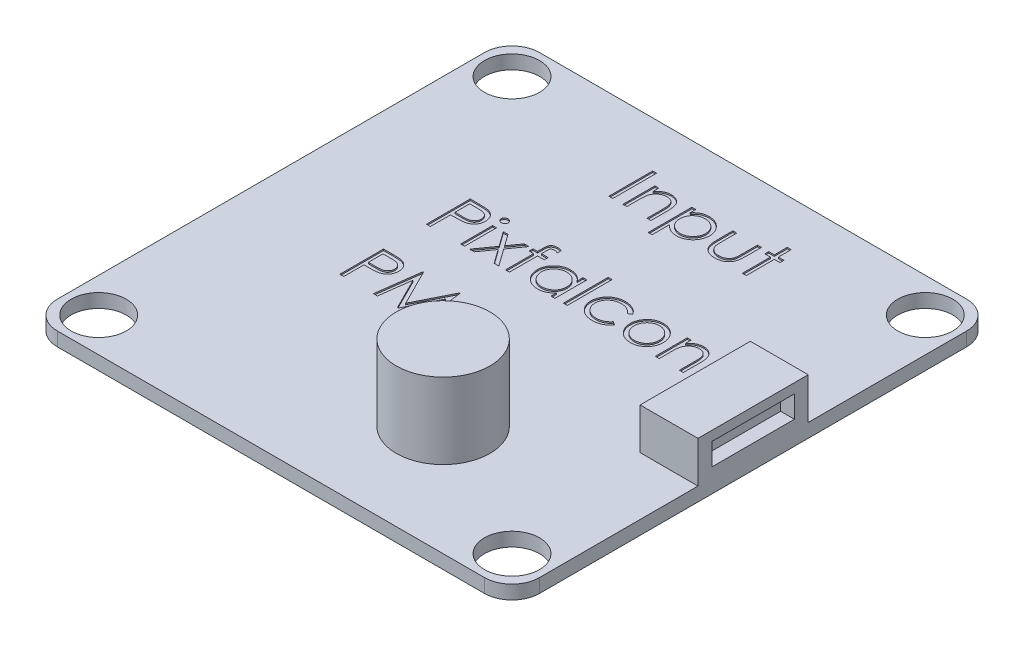
from build123d import *

# Parameters (mm, degrees)
SKETCH1_R           = 2
BOSS_EXTRUDE1_DEPTH = 1
SKETCH2_W           = 4.2
SKETCH2_H           = 8
BOSS_EXTRUDE2_DEPTH = 3
SKETCH3_W           = 6
SKETCH3_H           = 1.6
CUT_EXTRUDE1_DEPTH  = 1
SKETCH4_R           = 3.4
BOSS_EXTRUDE3_DEPTH = 5.5
SKETCH5_W           = 0.284935898
SKETCH5_H           = 2.320192307
SKETCH5_W_2         = 0.284935897
SKETCH5_H_2         = 3.256410256
SKETCH5_H_3         = 3.175
CUT_EXTRUDE2_DEPTH  = 0.1


with BuildPart() as part:
    # Sketch1 → Boss-Extrude1 (new body)
    with BuildSketch(Plane(origin=(0, 0, 0), x_dir=(1, 0, 0), z_dir=(0, 1, 0))):
        with BuildLine():
            Line((-15.5, 17.5), (15.5, 17.5))
            ThreePointArc((15.5, 17.5), (16.914213562, 16.914213562), (17.5, 15.5))
            Line((17.5, 15.5), (17.5, -15.5))
            ThreePointArc((17.5, -15.5), (16.914213562, -16.914213562), (15.5, -17.5))
            Line((15.5, -17.5), (-15.5, -17.5))
            ThreePointArc((-15.5, -17.5), (-16.914213562, -16.914213562), (-17.5, -15.5))
            Line((-17.5, -15.5), (-17.5, 15.5))
            ThreePointArc((-17.5, 15.5), (-16.914213562, 16.914213562), (-15.5, 17.5))
        make_face()
        with Locations((15, 15)):
            Circle(SKETCH1_R, mode=Mode.SUBTRACT)
        with Locations((15, -15)):
            Circle(SKETCH1_R, mode=Mode.SUBTRACT)
        with Locations((-15, -15)):
            Circle(SKETCH1_R, mode=Mode.SUBTRACT)
        with Locations((-15, 15)):
            Circle(SKETCH1_R, mode=Mode.SUBTRACT)
    extrude(amount=BOSS_EXTRUDE1_DEPTH)

    # Sketch2 → Boss-Extrude2 (add)
    with BuildSketch(Plane(origin=(0, 1, 0), x_dir=(1, 0, 0), z_dir=(0, 1, 0))):
        with Locations((15.4, 0)):
            Rectangle(SKETCH2_W, SKETCH2_H)
    extrude(amount=BOSS_EXTRUDE2_DEPTH)

    # Sketch3 → Cut-Extrude1 (cut)
    with BuildSketch(Plane(origin=(17.5, 0, 0), x_dir=(0, 0, -1), z_dir=(1, 0, 0))):
        with Locations((0, 2.5)):
            Rectangle(SKETCH3_W, SKETCH3_H)
    extrude(amount=-CUT_EXTRUDE1_DEPTH, mode=Mode.SUBTRACT)

    # Sketch4 → Boss-Extrude3 (add)
    with BuildSketch(Plane(origin=(0, 1, 0), x_dir=(1, 0, 0), z_dir=(0, 1, 0))):
        with Locations((4.5, -9.5)):
            Circle(SKETCH4_R)
    extrude(amount=BOSS_EXTRUDE3_DEPTH)

    # Sketch5 → Cut-Extrude2 (cut)
    # profile 1 of 17: a face of its own
    with BuildSketch(Plane(origin=(0, 1, 0), x_dir=(1, 0, 0), z_dir=(0, 1, 0))):
        with BuildLine():
            Line((-8.813380042, 5.781823516), (-8.190718784, 5.781823516))
            add(Edge.make_bspline(
                [(-8.190718784, 5.781823516), (-8.147891748, 5.781776438), (-8.065833244, 5.781686236), (-7.948163158, 5.778951431), (-7.841292901, 5.775298646), (-7.745452913, 5.770235072), (-7.66034831, 5.764251022), (-7.586364188, 5.7558581), (-7.522919019, 5.747094832), (-7.484903883, 5.738185414), (-7.467566741, 5.734122194)],
                knots=[0, 0, 0, 0, 1.415646017, 2.712440637, 3.8905458, 4.950247383, 5.884950622, 6.709939814, 7.411656543, 8, 8, 8, 8], degree=3))
            add(Edge.make_bspline(
                [(-7.467566741, 5.734122194), (-7.445619749, 5.728115139), (-7.40224292, 5.716242579), (-7.339739831, 5.692462987), (-7.280273128, 5.664267023), (-7.223638786, 5.632132449), (-7.170532754, 5.594680544), (-7.120162702, 5.553429477), (-7.072973149, 5.507426839), (-7.029229457, 5.457188597), (-6.989056819, 5.403558121), (-6.95446775, 5.345734812), (-6.925505194, 5.284691987), (-6.900664655, 5.220472104), (-6.882786271, 5.152535882), (-6.869318012, 5.081355365), (-6.860769436, 5.006938182), (-6.859950683, 4.956083873), (-6.859533888, 4.930195912)],
                knots=[0, 0, 0, 0, 0.999701418, 1.975846123, 2.934577507, 3.890451536, 4.834027766, 5.787354733, 6.749476667, 7.726910423, 8.712836071, 9.690891519, 10.682875813, 11.679750201, 12.712814741, 13.765529915, 14.8625177, 16, 16, 16, 16], degree=3))
            add(Edge.make_bspline(
                [(-6.859533888, 4.930195912), (-6.859916181, 4.904090357), (-6.860664162, 4.853013076), (-6.869641506, 4.77828919), (-6.881733894, 4.706880364), (-6.900327649, 4.638944934), (-6.924680509, 4.574886342), (-6.9532483, 4.513725653), (-6.987704789, 4.45650338), (-7.027296884, 4.40301178), (-7.071340116, 4.353200645), (-7.119648139, 4.307430939), (-7.172025925, 4.265970575), (-7.228307017, 4.228726606), (-7.289040094, 4.196562695), (-7.353304048, 4.167754283), (-7.421657458, 4.143559821), (-7.468958167, 4.130832551), (-7.493007446, 4.124361577)],
                knots=[0, 0, 0, 0, 1.121902311, 2.195077645, 3.232258892, 4.234102512, 5.217864754, 6.176164875, 7.132989551, 8.084763148, 9.034132444, 9.988522005, 10.94243251, 11.903244335, 12.886203696, 13.894208494, 14.929344452, 16, 16, 16, 16], degree=3))
            add(Edge.make_bspline(
                [(-7.493007446, 4.124361577), (-7.51289867, 4.120131587), (-7.556491445, 4.110861318), (-7.6282852, 4.100512218), (-7.711874229, 4.091678823), (-7.80714444, 4.085055648), (-7.914010318, 4.079385671), (-8.032529673, 4.0748789), (-8.162935157, 4.072402532), (-8.2538955, 4.072274813), (-8.301385851, 4.072208131)],
                knots=[0, 0, 0, 0, 0.601384939, 1.31797006, 2.144135048, 3.087295005, 4.142315834, 5.309527816, 6.595305764, 8, 8, 8, 8], degree=3))
            Line((-8.301385851, 4.072208131), (-8.528444145, 4.072208131))
            Line((-8.528444145, 4.072208131), (-8.528444145, 2.606823516))
            Line((-8.528444145, 2.606823516), (-8.813380042, 2.606823516))
            Line((-8.813380042, 2.606823516), (-8.813380042, 5.781823516))
        make_face()
        with BuildLine():
            Line((-8.528444145, 5.45618249), (-8.528444145, 4.397849157))
            Line((-8.528444145, 4.397849157), (-7.972564738, 4.390852963))
            add(Edge.make_bspline(
                [(-7.972564738, 4.390852963), (-7.945423091, 4.390838935), (-7.893026701, 4.390811855), (-7.817338127, 4.394427022), (-7.747116845, 4.398600362), (-7.682578551, 4.404710807), (-7.623694154, 4.413347948), (-7.570365467, 4.422067167), (-7.523006003, 4.434681318), (-7.467580298, 4.451665816), (-7.405818976, 4.48063326), (-7.338629129, 4.522679232), (-7.281687239, 4.576273874), (-7.232412785, 4.636533407), (-7.193309595, 4.703570475), (-7.164683802, 4.775297296), (-7.147864324, 4.850978274), (-7.145608991, 4.902765371), (-7.144469786, 4.928923876)],
                knots=[0, 0, 0, 0, 1.160613943, 2.240541288, 3.23993089, 4.169200891, 5.011653406, 5.7853311, 6.478053781, 7.106038997, 8.262395093, 9.384106736, 10.481365981, 11.59014053, 12.70357646, 13.786202915, 14.881775077, 16, 16, 16, 16], degree=3))
            add(Edge.make_bspline(
                [(-7.144469786, 4.928923876), (-7.145615186, 4.954449528), (-7.147892101, 5.005191364), (-7.164815634, 5.079557811), (-7.19325394, 5.150528771), (-7.23267528, 5.216725784), (-7.280519019, 5.276768485), (-7.33612628, 5.328926593), (-7.399366167, 5.370856281), (-7.458192777, 5.397919329), (-7.510445281, 5.414443186), (-7.555831417, 5.426004577), (-7.607076528, 5.435235306), (-7.6641973, 5.442709712), (-7.726750999, 5.449108209), (-7.795275042, 5.453449774), (-7.869509847, 5.455991095), (-7.92104515, 5.456117147), (-7.94776005, 5.45618249)],
                knots=[0, 0, 0, 0, 1.120700087, 2.227813068, 3.331159281, 4.466773991, 5.599788987, 6.693661531, 7.80175334, 8.91857717, 9.525282508, 10.207424825, 10.974604443, 11.810962634, 12.737642355, 13.736264703, 14.826523623, 16, 16, 16, 16], degree=3))
            Line((-7.94776005, 5.45618249), (-8.528444145, 5.45618249))
        make_face(mode=Mode.SUBTRACT)
    # profile 2 of 17: a face of its own
    with BuildSketch(Plane(origin=(0, 1, 0), x_dir=(1, 0, 0), z_dir=(0, 1, 0))):
        with BuildLine():
            add(Edge.make_bspline(
                [(-6.189171308, 5.9039389), (-6.1714899, 5.903118705), (-6.136866308, 5.901512605), (-6.086798129, 5.887758979), (-6.04120784, 5.864445693), (-6.000769468, 5.833167697), (-5.966069542, 5.796383559), (-5.941775612, 5.753511109), (-5.92616151, 5.70719363), (-5.924275963, 5.674885656), (-5.92331594, 5.658436096)],
                knots=[0, 0, 0, 0, 1.055194115, 2.066272739, 3.074728998, 4.095836921, 5.109056067, 6.073838105, 7.019297344, 8, 8, 8, 8], degree=3))
            add(Edge.make_bspline(
                [(-5.92331594, 5.658436096), (-5.924297613, 5.642413546), (-5.926238266, 5.610738862), (-5.941763551, 5.565224355), (-5.966276581, 5.522947612), (-6.000747217, 5.486234896), (-6.041213736, 5.454974191), (-6.086796563, 5.431656321), (-6.13686672, 5.41790391), (-6.171490039, 5.416297643), (-6.189171308, 5.415477362)],
                knots=[0, 0, 0, 0, 0.96129708, 1.900370562, 2.859976407, 3.87933698, 4.906634145, 5.921202961, 6.938410037, 8, 8, 8, 8], degree=3))
            add(Edge.make_bspline(
                [(-6.189171308, 5.415477362), (-6.206650386, 5.416266322), (-6.240671128, 5.417801931), (-6.289989621, 5.431926161), (-6.335191179, 5.45498217), (-6.375708418, 5.48603021), (-6.409481522, 5.523173081), (-6.434063574, 5.565198555), (-6.449553004, 5.61074543), (-6.451498488, 5.642415753), (-6.452482606, 5.658436096)],
                knots=[0, 0, 0, 0, 1.054934014, 2.053291228, 3.073705704, 4.106921865, 5.123545215, 6.088680038, 7.033164197, 8, 8, 8, 8], degree=3))
            add(Edge.make_bspline(
                [(-6.452482606, 5.658436096), (-6.451520049, 5.674883367), (-6.449629526, 5.707186844), (-6.434051964, 5.753537338), (-6.409686281, 5.796156272), (-6.375686055, 5.833372261), (-6.335197131, 5.864437762), (-6.289988083, 5.887489153), (-6.240671535, 5.901614582), (-6.206650524, 5.903150025), (-6.189171308, 5.9039389)],
                knots=[0, 0, 0, 0, 0.98631895, 1.937192651, 2.907499808, 3.917963147, 4.944918757, 5.95915025, 6.951458133, 8, 8, 8, 8], degree=3))
        make_face()
    # profile 3 of 17: a face of its own
    with BuildSketch(Plane(origin=(0, 1, 0), x_dir=(1, 0, 0), z_dir=(0, 1, 0))):
        with Locations((-6.187899273, 3.76691967)):
            Rectangle(SKETCH5_W, SKETCH5_H)
    # profile 4 of 17: a face of its own
    with BuildSketch(Plane(origin=(0, 1, 0), x_dir=(1, 0, 0), z_dir=(0, 1, 0))):
        Polygon((-5.556969786, 4.927015823), (-5.21797239, 4.927015823), (-4.620751837, 4.090016625), (-4.023531284, 4.927015823), (-3.684533888, 4.927015823), (-4.45093513, 3.852782049), (-3.562418504, 2.606823516), (-3.901415899, 2.606823516), (-4.620751837, 3.614911456), (-5.340087774, 2.606823516), (-5.67908517, 2.606823516), (-4.789932526, 3.852782049), align=None)
    # profile 5 of 17: a face of its own
    with BuildSketch(Plane(origin=(0, 1, 0), x_dir=(1, 0, 0), z_dir=(0, 1, 0))):
        with BuildLine():
            Line((-2.259854401, 5.844153243), (-2.259854401, 5.547769029))
            add(Edge.make_bspline(
                [(-2.259854401, 5.547769029), (-2.286831722, 5.558610177), (-2.338035238, 5.579186902), (-2.413546151, 5.601561241), (-2.482968736, 5.616017234), (-2.527558336, 5.618045555), (-2.548606404, 5.619003003)],
                knots=[0, 0, 0, 0, 1.16548392, 2.212112691, 3.15604595, 4, 4, 4, 4], degree=3))
            add(Edge.make_bspline(
                [(-2.548606404, 5.619003003), (-2.562824747, 5.618412144), (-2.590346717, 5.617268439), (-2.629901163, 5.611437075), (-2.665542089, 5.599550963), (-2.697206474, 5.584102976), (-2.723468677, 5.56473168), (-2.745953323, 5.545268691), (-2.762251532, 5.523329278), (-2.771100663, 5.502900048), (-2.776498164, 5.483985219), (-2.778122066, 5.464613848), (-2.782099809, 5.440824856), (-2.78320907, 5.411647769), (-2.785737611, 5.37799031), (-2.785513872, 5.339140197), (-2.787585717, 5.295708789), (-2.787275552, 5.264956148), (-2.787113015, 5.248840743)],
                knots=[0, 0, 0, 0, 1.311993654, 2.539582093, 3.670788641, 4.763509788, 5.772417512, 6.671800701, 7.496729179, 8.266799162, 8.712543678, 9.304149002, 10.05334463, 10.934920737, 11.99209668, 13.165090968, 14.514413552, 16, 16, 16, 16], degree=3))
            Line((-2.787113015, 5.248840743), (-2.787113015, 4.927015823))
            Line((-2.787113015, 4.927015823), (-2.300559529, 4.927015823))
            Line((-2.300559529, 4.927015823), (-2.300559529, 4.642079926))
            Line((-2.300559529, 4.642079926), (-2.787749032, 4.642079926))
            Line((-2.787749032, 4.642079926), (-2.789021068, 2.606823516))
            Line((-2.789021068, 2.606823516), (-3.073956965, 2.606823516))
            Line((-3.073956965, 2.606823516), (-3.073956965, 4.642079926))
            Line((-3.073956965, 4.642079926), (-3.399597991, 4.642079926))
            Line((-3.399597991, 4.642079926), (-3.399597991, 4.927015823))
            Line((-3.399597991, 4.927015823), (-3.073956965, 4.927015823))
            Line((-3.073956965, 4.927015823), (-3.073956965, 5.297814101))
            add(Edge.make_bspline(
                [(-3.073956965, 5.297814101), (-3.073934092, 5.318384091), (-3.073890212, 5.357845626), (-3.070816948, 5.414641332), (-3.068190116, 5.467095475), (-3.062958053, 5.514800877), (-3.056914934, 5.558204165), (-3.048264275, 5.596660564), (-3.040089674, 5.63120616), (-3.025259166, 5.670306427), (-3.003104724, 5.714620378), (-2.967245189, 5.761450629), (-2.92425296, 5.803455831), (-2.872901124, 5.838841073), (-2.815102031, 5.868246542), (-2.750802677, 5.889330223), (-2.680703033, 5.901250484), (-2.632182257, 5.903023231), (-2.607120026, 5.9039389)],
                knots=[0, 0, 0, 0, 1.116398763, 2.141702935, 3.087165306, 3.966655413, 4.746276475, 5.464069668, 6.106083417, 6.67047701, 7.730773247, 8.782666744, 9.856985883, 10.980834087, 12.154321827, 13.366232824, 14.639591414, 16, 16, 16, 16], degree=3))
            add(Edge.make_bspline(
                [(-2.607120026, 5.9039389), (-2.581650395, 5.903070419), (-2.528178257, 5.901247089), (-2.444542768, 5.889968213), (-2.354194498, 5.870490922), (-2.292204056, 5.853184555), (-2.259854401, 5.844153243)],
                knots=[0, 0, 0, 0, 0.864728408, 1.815451418, 2.859995356, 4, 4, 4, 4], degree=3))
        make_face()
    # profile 6 of 17: a face of its own
    with BuildSketch(Plane(origin=(0, 1, 0), x_dir=(1, 0, 0), z_dir=(0, 1, 0))):
        with BuildLine():
            Line((0.508094317, 4.927015823), (0.508094317, 2.606823516))
            Line((0.508094317, 2.606823516), (0.223158419, 2.606823516))
            Line((0.223158419, 2.606823516), (0.223158419, 3.008150639))
            add(Edge.make_bspline(
                [(0.223158419, 3.008150639), (0.191028517, 2.971829007), (0.128326607, 2.900946887), (0.023605021, 2.808343773), (-0.087400397, 2.731800581), (-0.204150881, 2.669978872), (-0.326541002, 2.623540364), (-0.454299453, 2.590532919), (-0.587478348, 2.569311369), (-0.678421556, 2.567192263), (-0.724507847, 2.566118388)],
                knots=[0, 0, 0, 0, 1.074387032, 2.096679803, 3.090159297, 4.057316773, 5.018401886, 5.985159533, 6.978961417, 8, 8, 8, 8], degree=3))
            add(Edge.make_bspline(
                [(-0.724507847, 2.566118388), (-0.765481633, 2.567230882), (-0.846283755, 2.569424771), (-0.965145846, 2.586444861), (-1.07952953, 2.613777639), (-1.189542892, 2.651787732), (-1.294474053, 2.702207477), (-1.395221426, 2.762569895), (-1.491263082, 2.834452648), (-1.581135121, 2.916628931), (-1.663895579, 3.005887241), (-1.73652259, 3.101087844), (-1.79707717, 3.201819077), (-1.847713957, 3.306805581), (-1.886717784, 3.416855544), (-1.913908152, 3.531588403), (-1.930908415, 3.650868503), (-1.933101397, 3.732093641), (-1.934213375, 3.773279846)],
                knots=[0, 0, 0, 0, 1.033919861, 2.038935746, 3.024066025, 3.998881131, 4.97069526, 5.957263378, 6.95902576, 7.993208707, 9.027059324, 10.027763471, 11.009749337, 11.988697705, 12.965288445, 13.950418724, 14.960734635, 16, 16, 16, 16], degree=3))
            add(Edge.make_bspline(
                [(-1.934213375, 3.773279846), (-1.933076751, 3.813614777), (-1.930829707, 3.89335476), (-1.91409, 4.010629007), (-1.885940443, 4.123584858), (-1.846436324, 4.231858657), (-1.795779693, 4.335581416), (-1.734159214, 4.434826496), (-1.661570437, 4.529867307), (-1.577884325, 4.618469062), (-1.487229212, 4.700312048), (-1.39024772, 4.771440254), (-1.289352315, 4.83286911), (-1.182978012, 4.881540477), (-1.072699282, 4.920918736), (-0.95753437, 4.948162929), (-0.837962438, 4.964216927), (-0.756781777, 4.966541721), (-0.7156036, 4.967720952)],
                knots=[0, 0, 0, 0, 1.020392517, 2.01726096, 2.990465484, 3.961182959, 4.928053699, 5.906110375, 6.912531644, 7.948652711, 8.985773172, 9.998621852, 10.987621588, 11.969261332, 12.953316658, 13.946091881, 14.958173133, 16, 16, 16, 16], degree=3))
            add(Edge.make_bspline(
                [(-0.7156036, 4.967720952), (-0.66825087, 4.966416706), (-0.575394403, 4.963859141), (-0.439569709, 4.942575095), (-0.311077933, 4.906617343), (-0.188927199, 4.85770647), (-0.073556148, 4.792710837), (0.033942988, 4.710723301), (0.134695248, 4.612260938), (0.193097369, 4.536632035), (0.223158419, 4.497703924)],
                knots=[0, 0, 0, 0, 1.038897134, 2.037228247, 3.008116434, 3.962042015, 4.918381754, 5.904844433, 6.921570401, 8, 8, 8, 8], degree=3))
            Line((0.223158419, 4.497703924), (0.223158419, 4.927015823))
            Line((0.223158419, 4.927015823), (0.508094317, 4.927015823))
        make_face()
        with BuildLine():
            add(Edge.make_bspline(
                [(-0.711787494, 4.682785054), (-0.753438358, 4.681303111), (-0.835650538, 4.678377992), (-0.956340454, 4.655542036), (-1.071831908, 4.617546725), (-1.181547275, 4.565583858), (-1.283753443, 4.500243504), (-1.375096988, 4.421211963), (-1.456325009, 4.330645529), (-1.524640363, 4.2289529), (-1.580330314, 4.119934203), (-1.619488979, 4.005974892), (-1.645314653, 3.889130376), (-1.647953097, 3.80987994), (-1.649277478, 3.770099758)],
                knots=[0, 0, 0, 0, 1.031046209, 2.035121221, 3.029706178, 4.034933723, 5.034054252, 6.02443088, 7.017295772, 8.038157696, 9.050218397, 10.03989886, 11.016116709, 12, 12, 12, 12], degree=3))
            add(Edge.make_bspline(
                [(-1.649277478, 3.770099758), (-1.647585753, 3.730557303), (-1.644208935, 3.651627388), (-1.619942234, 3.534623579), (-1.579229777, 3.420637412), (-1.523674477, 3.310636368), (-1.454108753, 3.208506505), (-1.373474047, 3.11621368), (-1.280990578, 3.036848125), (-1.178549196, 2.970411183), (-1.069140537, 2.916742325), (-0.954084042, 2.879399209), (-0.835542571, 2.855289365), (-0.754940811, 2.852473161), (-0.714331565, 2.851054285)],
                knots=[0, 0, 0, 0, 0.979072187, 1.954306742, 2.945804271, 3.96968567, 4.997920485, 5.998718438, 6.996577872, 8.005894225, 9.015743152, 10.005417472, 10.995077863, 12, 12, 12, 12], degree=3))
            add(Edge.make_bspline(
                [(-0.714331565, 2.851054285), (-0.673105094, 2.852560109), (-0.591109734, 2.855555045), (-0.470061763, 2.878488764), (-0.352591332, 2.916379031), (-0.240298632, 2.96890181), (-0.135690428, 3.033995983), (-0.041803067, 3.110202416), (0.037586418, 3.198833161), (0.104889714, 3.296238944), (0.157663128, 3.403020541), (0.196104267, 3.516716556), (0.218831739, 3.637330949), (0.221696251, 3.719757512), (0.223158419, 3.761831529)],
                knots=[0, 0, 0, 0, 1.01762866, 2.023962475, 3.030623092, 4.058876274, 5.077231937, 6.066672613, 7.034107872, 8.005628644, 8.981990164, 9.965428785, 10.961468474, 12, 12, 12, 12], degree=3))
            add(Edge.make_bspline(
                [(0.223158419, 3.761831529), (0.222287874, 3.793887989), (0.220574365, 3.856985248), (0.207483777, 3.949629496), (0.18666038, 4.038287947), (0.157317782, 4.123053815), (0.118772117, 4.203458436), (0.072283073, 4.280079133), (0.017033129, 4.352517404), (-0.046088317, 4.419775761), (-0.115181036, 4.481122623), (-0.188291798, 4.535881613), (-0.266286804, 4.580865714), (-0.347854402, 4.61809601), (-0.433136113, 4.647722525), (-0.522825889, 4.667487075), (-0.615970399, 4.681058224), (-0.679512178, 4.682203383), (-0.711787494, 4.682785054)],
                knots=[0, 0, 0, 0, 1.050140795, 2.067009409, 3.05949893, 4.030605086, 5.00011959, 5.97591094, 6.962425594, 7.979863591, 8.993523472, 9.986985069, 10.967611495, 11.937549037, 12.921786183, 13.919465291, 14.943216303, 16, 16, 16, 16], degree=3))
        make_face(mode=Mode.SUBTRACT)
    # profile 7 of 17: a face of its own
    with BuildSketch(Plane(origin=(0, 1, 0), x_dir=(1, 0, 0), z_dir=(0, 1, 0))):
        with Locations((1.261139189, 4.235028644)):
            Rectangle(SKETCH5_W_2, SKETCH5_H_2)
    # profile 8 of 17: a face of its own
    with BuildSketch(Plane(origin=(0, 1, 0), x_dir=(1, 0, 0), z_dir=(0, 1, 0))):
        with BuildLine():
            Line((4.334376368, 4.42392588), (4.095869758, 4.275733772))
            add(Edge.make_bspline(
                [(4.095869758, 4.275733772), (4.069716951, 4.308235244), (4.018239592, 4.372208872), (3.928850428, 4.454767883), (3.833590073, 4.525676557), (3.730830701, 4.583464959), (3.62071644, 4.628115847), (3.503681539, 4.659711819), (3.379742688, 4.679400668), (3.294774972, 4.681638441), (3.251238347, 4.682785054)],
                knots=[0, 0, 0, 0, 1.026593902, 2.0206758, 2.988051866, 3.946915611, 4.916868779, 5.907761954, 6.927957743, 8, 8, 8, 8], degree=3))
            add(Edge.make_bspline(
                [(3.251238347, 4.682785054), (3.216441294, 4.681826347), (3.147909442, 4.6799382), (3.047301717, 4.668135824), (2.951469011, 4.646689145), (2.859810654, 4.618430777), (2.77297856, 4.5805573), (2.690745227, 4.534465593), (2.612381247, 4.48089877), (2.540157488, 4.418840633), (2.474091175, 4.351350413), (2.416851446, 4.279002418), (2.367015799, 4.203963659), (2.327912539, 4.124360293), (2.29591292, 4.042013445), (2.274861109, 3.955368733), (2.260832421, 3.865536183), (2.259227388, 3.804287404), (2.25841483, 3.773279846)],
                knots=[0, 0, 0, 0, 1.112346261, 2.190735716, 3.231507886, 4.247384806, 5.251966152, 6.253067467, 7.256802811, 8.280671706, 9.291813951, 10.270744147, 11.225547591, 12.165006084, 13.100104208, 14.043489273, 15.009504848, 16, 16, 16, 16], degree=3))
            add(Edge.make_bspline(
                [(2.25841483, 3.773279846), (2.260028866, 3.732667776), (2.26323519, 3.651990848), (2.288364371, 3.532902856), (2.329498226, 3.417764937), (2.385793562, 3.307394555), (2.456983534, 3.205255572), (2.540597217, 3.113649152), (2.636680956, 3.034350327), (2.744388142, 2.968607393), (2.861189809, 2.91575601), (2.985822262, 2.878102929), (3.117267062, 2.855376848), (3.207261754, 2.852513957), (3.2531464, 2.851054285)],
                knots=[0, 0, 0, 0, 0.966302908, 1.919585723, 2.883856336, 3.870342332, 4.860282998, 5.839159637, 6.814385684, 7.815993281, 8.834850808, 9.858348828, 10.908058873, 12, 12, 12, 12], degree=3))
            add(Edge.make_bspline(
                [(3.2531464, 2.851054285), (3.295197175, 2.852233115), (3.377838105, 2.854549828), (3.498639857, 2.874079673), (3.613647347, 2.906050683), (3.722856489, 2.950634623), (3.826067726, 3.008263155), (3.922614191, 3.079346117), (4.014416993, 3.161838605), (4.06838925, 3.22562705), (4.095869758, 3.258105567)],
                knots=[0, 0, 0, 0, 1.039848629, 2.043578496, 3.018386758, 3.987534228, 4.954977003, 5.934852016, 6.948509513, 8, 8, 8, 8], degree=3))
            Line((4.095869758, 3.258105567), (4.334376368, 3.10164523))
            add(Edge.make_bspline(
                [(4.334376368, 3.10164523), (4.320236095, 3.080880071), (4.292002483, 3.039418674), (4.244805995, 2.980958654), (4.19389729, 2.926238271), (4.139474981, 2.875330874), (4.082249679, 2.827018243), (4.020266504, 2.783610029), (3.955524071, 2.742666297), (3.887262335, 2.70582462), (3.816187059, 2.672708171), (3.742398254, 2.644231894), (3.666216566, 2.619766156), (3.587552425, 2.60031942), (3.506250746, 2.584797445), (3.422521792, 2.574498015), (3.3363944, 2.566809725), (3.278181091, 2.566350831), (3.248694277, 2.566118388)],
                knots=[0, 0, 0, 0, 0.954134338, 1.905101784, 2.851144739, 3.791306361, 4.734911809, 5.6936923, 6.663572882, 7.643865596, 8.638447847, 9.640600242, 10.646758161, 11.676244097, 12.717260333, 13.78922464, 14.880174919, 16, 16, 16, 16], degree=3))
            add(Edge.make_bspline(
                [(3.248694277, 2.566118388), (3.203690118, 2.566926906), (3.11548164, 2.568511607), (2.986374794, 2.585936438), (2.862990967, 2.612205133), (2.745372314, 2.649909377), (2.633500523, 2.698445852), (2.527479909, 2.75773391), (2.427661521, 2.828265891), (2.335032453, 2.908786403), (2.249959284, 2.996090413), (2.176910526, 3.090297125), (2.113550888, 3.187942932), (2.062671474, 3.291184431), (2.022170333, 3.398649447), (1.994498092, 3.511198879), (1.976600402, 3.627904853), (1.97452905, 3.70749111), (1.973478932, 3.747839141)],
                knots=[0, 0, 0, 0, 1.1129367, 2.181364009, 3.217532258, 4.231199276, 5.232079859, 6.230262199, 7.231623845, 8.250719726, 9.263571943, 10.242672461, 11.195837495, 12.138959767, 13.085126421, 14.0317438, 15.002148558, 16, 16, 16, 16], degree=3))
            add(Edge.make_bspline(
                [(1.973478932, 3.747839141), (1.973878997, 3.775215292), (1.974674792, 3.829670976), (1.983802397, 3.910492929), (1.995593869, 3.990238538), (2.015574359, 4.067896969), (2.038652647, 4.144646054), (2.068112593, 4.219560724), (2.102670559, 4.292989106), (2.141906254, 4.364742046), (2.186073901, 4.433639129), (2.234951877, 4.498729953), (2.286699239, 4.560796454), (2.343736855, 4.617695866), (2.403644255, 4.671703697), (2.468116328, 4.721377138), (2.536783279, 4.76686218), (2.608613864, 4.808999887), (2.683566281, 4.846518803), (2.761187475, 4.87884324), (2.841009723, 4.906468077), (2.923160711, 4.92833831), (3.007095168, 4.946678402), (3.093474524, 4.958215305), (3.181968326, 4.966367138), (3.241890575, 4.967265928), (3.272226929, 4.967720952)],
                knots=[0, 0, 0, 0, 0.990994727, 1.971252077, 2.943264845, 3.907940874, 4.872158414, 5.844625996, 6.82015047, 7.809835459, 8.804511986, 9.781214284, 10.756496977, 11.728388426, 12.696359165, 13.676225489, 14.672885716, 15.677705647, 16.690706858, 17.706033469, 18.721040654, 19.747369689, 20.783475414, 21.830280724, 22.901553713, 24, 24, 24, 24], degree=3))
            add(Edge.make_bspline(
                [(3.272226929, 4.967720952), (3.31021817, 4.966884665), (3.386010754, 4.965216271), (3.49844268, 4.951174922), (3.609218606, 4.930005459), (3.716394907, 4.898642963), (3.818672103, 4.860666647), (3.914407832, 4.818019399), (4.001348498, 4.768494294), (4.081111382, 4.714319619), (4.153845659, 4.653213655), (4.220297949, 4.584445915), (4.281830945, 4.508374295), (4.316716676, 4.452307667), (4.334376368, 4.42392588)],
                knots=[0, 0, 0, 0, 1.095225653, 2.184976855, 3.262915854, 4.344593502, 5.400796181, 6.407717688, 7.363229445, 8.282371371, 9.184954523, 10.097238608, 11.036792983, 12, 12, 12, 12], degree=3))
        make_face()
    # profile 9 of 17: a face of its own
    with BuildSketch(Plane(origin=(0, 1, 0), x_dir=(1, 0, 0), z_dir=(0, 1, 0))):
        with BuildLine():
            add(Edge.make_bspline(
                [(6.024911224, 4.967720952), (6.068446164, 4.96679395), (6.153807543, 4.964976327), (6.278818982, 4.945549894), (6.398149213, 4.915843357), (6.512255259, 4.874775582), (6.619675755, 4.819728384), (6.721975384, 4.754042813), (6.81887367, 4.676225746), (6.876951704, 4.616029498), (6.906431657, 4.585474357)],
                knots=[0, 0, 0, 0, 1.054011418, 2.066658804, 3.057071809, 4.030435133, 4.997543892, 5.974964718, 6.972108034, 8, 8, 8, 8], degree=3))
            add(Edge.make_bspline(
                [(6.906431657, 4.585474357), (6.931815286, 4.55625167), (6.982091303, 4.498371835), (7.046558062, 4.404522815), (7.102094763, 4.307331438), (7.146601878, 4.205507077), (7.18169472, 4.099938626), (7.206610031, 3.99026323), (7.221429964, 3.876723101), (7.22342837, 3.799612476), (7.224440471, 3.760559493)],
                knots=[0, 0, 0, 0, 1.025258237, 2.030674902, 3.01204498, 3.988269485, 4.97094183, 5.956517959, 6.965070386, 8, 8, 8, 8], degree=3))
            add(Edge.make_bspline(
                [(7.224440471, 3.760559493), (7.223550258, 3.721280155), (7.221791155, 3.643662351), (7.205150874, 3.529344784), (7.179269104, 3.418496623), (7.142228793, 3.311581951), (7.094732508, 3.208273958), (7.036774528, 3.109023867), (6.967948132, 3.01363586), (6.889930221, 2.922919907), (6.80370459, 2.839311983), (6.710163513, 2.766442767), (6.611145211, 2.704011813), (6.505333026, 2.653723065), (6.393693234, 2.614072122), (6.275985037, 2.586222822), (6.152391294, 2.569384723), (6.068002315, 2.567222481), (6.024911224, 2.566118388)],
                knots=[0, 0, 0, 0, 0.998656419, 1.973391657, 2.932242238, 3.890759089, 4.846373663, 5.82037756, 6.809684879, 7.83454468, 8.860553229, 9.859544525, 10.845671541, 11.83227036, 12.833544569, 13.85385346, 14.904124723, 16, 16, 16, 16], degree=3))
            add(Edge.make_bspline(
                [(6.024911224, 2.566118388), (5.981609014, 2.567226187), (5.896799449, 2.569395868), (5.772769451, 2.586157403), (5.654850296, 2.614059287), (5.543064353, 2.65385337), (5.436797242, 2.70401342), (5.337205206, 2.766254025), (5.243588139, 2.839333594), (5.157344268, 2.922914051), (5.079331247, 3.013637369), (5.01050359, 3.109023475), (4.952545937, 3.20827406), (4.905049566, 3.311581924), (4.868009279, 3.418496631), (4.842127502, 3.529344782), (4.825487223, 3.643662352), (4.82372812, 3.721280155), (4.822837907, 3.760559493)],
                knots=[0, 0, 0, 0, 1.099876186, 2.154163076, 3.173186993, 4.173200201, 5.163417411, 6.152872554, 7.150605724, 8.17532212, 9.198891216, 10.186952605, 11.159729845, 12.11414092, 13.071450619, 14.029093627, 15.002601286, 16, 16, 16, 16], degree=3))
            add(Edge.make_bspline(
                [(4.822837907, 3.760559493), (4.82385691, 3.799400217), (4.82587436, 3.876298175), (4.840679394, 3.989624866), (4.865497513, 4.09911464), (4.900632422, 4.204275608), (4.945549774, 4.305653753), (5.000306085, 4.403085278), (5.065430445, 4.496509926), (5.115506501, 4.554314956), (5.140846721, 4.583566304)],
                knots=[0, 0, 0, 0, 1.031353054, 2.041901799, 3.029428768, 4.008703097, 4.981709435, 5.96992636, 6.972712378, 8, 8, 8, 8], degree=3))
            add(Edge.make_bspline(
                [(5.140846721, 4.583566304), (5.170282228, 4.614386428), (5.228172333, 4.674999623), (5.325552965, 4.752589842), (5.427600931, 4.81964228), (5.536208543, 4.873595704), (5.65022085, 4.916084931), (5.770162591, 4.945626505), (5.895598237, 4.964906335), (5.981377322, 4.966773396), (6.024911224, 4.967720952)],
                knots=[0, 0, 0, 0, 1.027980169, 2.021703884, 2.998553061, 3.971491411, 4.943284454, 5.930300938, 6.949603206, 8, 8, 8, 8], degree=3))
        make_face()
        with BuildLine():
            add(Edge.make_bspline(
                [(6.023639189, 4.682785054), (5.992852927, 4.681910032), (5.932075146, 4.680182575), (5.842613094, 4.667043605), (5.756488812, 4.64622694), (5.673538903, 4.616650404), (5.594043097, 4.578460688), (5.517925282, 4.531553818), (5.444961568, 4.476551065), (5.376579268, 4.413538499), (5.313821028, 4.344705411), (5.258958863, 4.2713644), (5.212308945, 4.194705071), (5.173446801, 4.114647708), (5.144502423, 4.030381018), (5.123481181, 3.942859303), (5.110354606, 3.851904247), (5.108643391, 3.790072466), (5.107773804, 3.75865144)],
                knots=[0, 0, 0, 0, 1.021534396, 2.016698045, 2.994645724, 3.958388632, 4.93408049, 5.916473867, 6.921342795, 7.962252576, 8.998418191, 10.008913653, 10.997312074, 11.973003931, 12.956656626, 13.948281152, 14.957379055, 16, 16, 16, 16], degree=3))
            add(Edge.make_bspline(
                [(5.107773804, 3.75865144), (5.109231423, 3.718054959), (5.112124523, 3.637478534), (5.135651487, 3.518814158), (5.175009041, 3.404893478), (5.228156074, 3.296384328), (5.294746001, 3.195988761), (5.373202125, 3.106479629), (5.462682425, 3.029203929), (5.56212025, 2.965086304), (5.669484524, 2.914141383), (5.783109901, 2.878038027), (5.901619674, 2.854568706), (5.982610051, 2.852236011), (6.023639189, 2.851054285)],
                knots=[0, 0, 0, 0, 1.016792936, 2.018143844, 3.017858371, 4.030088057, 5.03801393, 6.028138512, 7.003788237, 7.991172063, 8.984598303, 9.972568034, 10.972917682, 12, 12, 12, 12], degree=3))
            add(Edge.make_bspline(
                [(6.023639189, 2.851054285), (6.064665966, 2.852242896), (6.145651685, 2.854589182), (6.263996796, 2.877919826), (6.377311613, 2.914299575), (6.484564372, 2.965029008), (6.583956934, 3.029447413), (6.674080779, 3.10604327), (6.751867019, 3.196225835), (6.818391075, 3.296517307), (6.872408478, 3.404725255), (6.911581811, 3.518835184), (6.935165335, 3.637473179), (6.938050801, 3.718053165), (6.939504573, 3.75865144)],
                knots=[0, 0, 0, 0, 1.02726834, 2.027799167, 3.010890988, 4.004497153, 4.992059811, 5.971914811, 6.958719428, 7.966827853, 8.981595046, 9.981490638, 10.983022906, 12, 12, 12, 12], degree=3))
            add(Edge.make_bspline(
                [(6.939504573, 3.75865144), (6.938635286, 3.790072653), (6.93692466, 3.851904804), (6.923793799, 3.942857173), (6.902788417, 4.030388835), (6.873785593, 4.114618867), (6.835092309, 4.194912353), (6.787542789, 4.271139319), (6.732904645, 4.344959472), (6.669389114, 4.413315989), (6.601078192, 4.476575629), (6.528084908, 4.531575147), (6.452079963, 4.578254537), (6.372815106, 4.616977055), (6.289854562, 4.645957857), (6.203850952, 4.667163801), (6.114770603, 4.680127051), (6.054210614, 4.681893386), (6.023639189, 4.682785054)],
                knots=[0, 0, 0, 0, 1.042956736, 2.052379634, 3.044323526, 4.02829302, 5.004299113, 5.996692471, 7.007513377, 8.048758398, 9.090003419, 10.095195979, 11.07790575, 12.047570684, 13.018257071, 13.989683339, 14.985167495, 16, 16, 16, 16], degree=3))
        make_face(mode=Mode.SUBTRACT)
    # profile 10 of 17: a face of its own
    with BuildSketch(Plane(origin=(0, 1, 0), x_dir=(1, 0, 0), z_dir=(0, 1, 0))):
        with BuildLine():
            Line((7.794312266, 4.927015823), (8.079248163, 4.927015823))
            Line((8.079248163, 4.927015823), (8.079248163, 4.508516224))
            add(Edge.make_bspline(
                [(8.079248163, 4.508516224), (8.109671589, 4.546473551), (8.168709309, 4.620131069), (8.267029383, 4.716941876), (8.370937064, 4.796720758), (8.479796024, 4.860314914), (8.59375404, 4.908254354), (8.712116471, 4.942876306), (8.835591954, 4.963636114), (8.919561122, 4.96634868), (8.962040631, 4.967720952)],
                knots=[0, 0, 0, 0, 1.12780773, 2.188550248, 3.19190651, 4.159438251, 5.104880172, 6.052711206, 7.014878035, 8, 8, 8, 8], degree=3))
            add(Edge.make_bspline(
                [(8.962040631, 4.967720952), (9.004976278, 4.96613781), (9.089011695, 4.96303922), (9.211365365, 4.938531222), (9.325641229, 4.896670883), (9.431431826, 4.839328505), (9.526797227, 4.768021204), (9.610549056, 4.684947074), (9.679821431, 4.589392198), (9.726264753, 4.500743335), (9.756858733, 4.422104214), (9.776119497, 4.354751805), (9.792476173, 4.279714625), (9.806656401, 4.197219427), (9.816251353, 4.106688211), (9.823819003, 4.008492091), (9.829242533, 3.902662872), (9.829457713, 3.829468575), (9.829568676, 3.791724357)],
                knots=[0, 0, 0, 0, 1.235846778, 2.418850247, 3.575807741, 4.728682307, 5.871620074, 6.994088408, 8.11269785, 9.256955736, 9.865816715, 10.540099792, 11.271859618, 12.076849838, 12.949306005, 13.892391288, 14.913166135, 16, 16, 16, 16], degree=3))
            Line((9.829568676, 3.791724357), (9.829568676, 2.606823516))
            Line((9.829568676, 2.606823516), (9.544632778, 2.606823516))
            Line((9.544632778, 2.606823516), (9.544632778, 3.698229766))
            add(Edge.make_bspline(
                [(9.544632778, 3.698229766), (9.544457511, 3.729818698), (9.544122255, 3.790242949), (9.543064847, 3.876756277), (9.540515951, 3.955211959), (9.536934267, 4.025422428), (9.531691861, 4.087320266), (9.526228474, 4.141031538), (9.519547387, 4.186488052), (9.513593888, 4.213852091), (9.510923844, 4.226124397)],
                knots=[0, 0, 0, 0, 1.430800155, 2.736877192, 3.918605307, 4.986035426, 5.920637409, 6.731861385, 7.431261377, 8, 8, 8, 8], degree=3))
            add(Edge.make_bspline(
                [(9.510923844, 4.226124397), (9.501284969, 4.262148115), (9.482733117, 4.331482626), (9.436891575, 4.425530075), (9.379002997, 4.505538431), (9.308338519, 4.571013028), (9.225580715, 4.621968001), (9.130959235, 4.657322946), (9.025387183, 4.679435705), (8.951133564, 4.68163746), (8.912431256, 4.682785054)],
                knots=[0, 0, 0, 0, 1.084156227, 2.086665306, 3.027808233, 3.945421172, 4.874247719, 5.839848303, 6.874090471, 8, 8, 8, 8], degree=3))
            add(Edge.make_bspline(
                [(8.912431256, 4.682785054), (8.889509857, 4.68235325), (8.844149002, 4.681498721), (8.776884384, 4.672925043), (8.711638884, 4.658902015), (8.647757695, 4.63997118), (8.586518482, 4.613970407), (8.525953732, 4.584461621), (8.468344024, 4.547678601), (8.412460943, 4.506684251), (8.360470039, 4.461255256), (8.312093617, 4.413317736), (8.268969842, 4.362267724), (8.229900401, 4.308927772), (8.196174405, 4.252565319), (8.166734818, 4.193724126), (8.141756009, 4.132326748), (8.129343852, 4.089713657), (8.123133379, 4.068392025)],
                knots=[0, 0, 0, 0, 1.023777757, 2.026029729, 3.023749952, 4.003683103, 4.997618607, 5.993177895, 7.010360494, 8.046726602, 9.087585522, 10.09234134, 11.086953743, 12.070360549, 13.043493632, 14.017870808, 15.008233677, 16, 16, 16, 16], degree=3))
            add(Edge.make_bspline(
                [(8.123133379, 4.068392025), (8.119559555, 4.052739091), (8.111779527, 4.018663472), (8.1033765, 3.962743177), (8.095749628, 3.898054843), (8.089366101, 3.824673955), (8.085460473, 3.742343597), (8.081201985, 3.651415373), (8.079651622, 3.551526709), (8.079386415, 3.481983602), (8.079248163, 3.445730767)],
                knots=[0, 0, 0, 0, 0.615963638, 1.340920617, 2.168419149, 3.115676021, 4.16674242, 5.331190069, 6.6087489, 8, 8, 8, 8], degree=3))
            Line((8.079248163, 3.445730767), (8.079248163, 2.606823516))
            Line((8.079248163, 2.606823516), (7.794312266, 2.606823516))
            Line((7.794312266, 2.606823516), (7.794312266, 4.927015823))
        make_face()
    # profile 11 of 17: a face of its own
    with BuildSketch(Plane(origin=(0, 1, 0), x_dir=(1, 0, 0), z_dir=(0, 1, 0))):
        with BuildLine():
            Line((-8.813380042, -0.509843151), (-8.190718784, -0.509843151))
            add(Edge.make_bspline(
                [(-8.190718784, -0.509843151), (-8.147891748, -0.509890228), (-8.065833244, -0.50998043), (-7.948163158, -0.512715236), (-7.841292901, -0.516368021), (-7.745452913, -0.521431595), (-7.66034831, -0.527415645), (-7.586364188, -0.535808566), (-7.522919019, -0.544571834), (-7.484903883, -0.553481253), (-7.467566741, -0.557544473)],
                knots=[0, 0, 0, 0, 1.415646017, 2.712440637, 3.8905458, 4.950247383, 5.884950622, 6.709939814, 7.411656543, 8, 8, 8, 8], degree=3))
            add(Edge.make_bspline(
                [(-7.467566741, -0.557544473), (-7.445619749, -0.563551528), (-7.40224292, -0.575424088), (-7.339739831, -0.59920368), (-7.280273128, -0.627399644), (-7.223638786, -0.659534218), (-7.170532754, -0.696986123), (-7.120162702, -0.73823719), (-7.072973149, -0.784239827), (-7.029229457, -0.83447807), (-6.989056819, -0.888108546), (-6.95446775, -0.945931855), (-6.925505194, -1.00697468), (-6.900664655, -1.071194562), (-6.882786271, -1.139130784), (-6.869318012, -1.210311302), (-6.860769436, -1.284728485), (-6.859950683, -1.335582794), (-6.859533888, -1.361470755)],
                knots=[0, 0, 0, 0, 0.999701418, 1.975846123, 2.934577507, 3.890451536, 4.834027766, 5.787354733, 6.749476667, 7.726910423, 8.712836071, 9.690891519, 10.682875813, 11.679750201, 12.712814741, 13.765529915, 14.8625177, 16, 16, 16, 16], degree=3))
            add(Edge.make_bspline(
                [(-6.859533888, -1.361470755), (-6.859916181, -1.38757631), (-6.860664162, -1.438653591), (-6.869641506, -1.513377477), (-6.881733894, -1.584786302), (-6.900327649, -1.652721732), (-6.924680509, -1.716780324), (-6.9532483, -1.777941013), (-6.987704789, -1.835163287), (-7.027296884, -1.888654887), (-7.071340116, -1.938466021), (-7.119648139, -1.984235728), (-7.172025925, -2.025696092), (-7.228307017, -2.062940061), (-7.289040094, -2.095103971), (-7.353304048, -2.123912384), (-7.421657458, -2.148106846), (-7.468958167, -2.160834116), (-7.493007446, -2.16730509)],
                knots=[0, 0, 0, 0, 1.121902311, 2.195077645, 3.232258892, 4.234102512, 5.217864754, 6.176164875, 7.132989551, 8.084763148, 9.034132444, 9.988522005, 10.94243251, 11.903244335, 12.886203696, 13.894208494, 14.929344452, 16, 16, 16, 16], degree=3))
            add(Edge.make_bspline(
                [(-7.493007446, -2.16730509), (-7.51289867, -2.17153508), (-7.556491445, -2.180805349), (-7.6282852, -2.191154449), (-7.711874229, -2.199987844), (-7.80714444, -2.206611019), (-7.914010318, -2.212280996), (-8.032529673, -2.216787767), (-8.162935157, -2.219264134), (-8.2538955, -2.219391853), (-8.301385851, -2.219458536)],
                knots=[0, 0, 0, 0, 0.601384939, 1.31797006, 2.144135048, 3.087295005, 4.142315834, 5.309527816, 6.595305764, 8, 8, 8, 8], degree=3))
            Line((-8.301385851, -2.219458536), (-8.528444145, -2.219458536))
            Line((-8.528444145, -2.219458536), (-8.528444145, -3.684843151))
            Line((-8.528444145, -3.684843151), (-8.813380042, -3.684843151))
            Line((-8.813380042, -3.684843151), (-8.813380042, -0.509843151))
        make_face()
        with BuildLine():
            Line((-8.528444145, -0.835484177), (-8.528444145, -1.89381751))
            Line((-8.528444145, -1.89381751), (-7.972564738, -1.900813704))
            add(Edge.make_bspline(
                [(-7.972564738, -1.900813704), (-7.945423091, -1.900827732), (-7.893026701, -1.900854812), (-7.817338127, -1.897239645), (-7.747116845, -1.893066304), (-7.682578551, -1.886955859), (-7.623694154, -1.878318719), (-7.570365467, -1.869599499), (-7.523006003, -1.856985349), (-7.467580298, -1.840000851), (-7.405818976, -1.811033406), (-7.338629129, -1.768987435), (-7.281687239, -1.715392792), (-7.232412785, -1.65513326), (-7.193309595, -1.588096192), (-7.164683802, -1.516369371), (-7.147864324, -1.440688393), (-7.145608991, -1.388901296), (-7.144469786, -1.36274279)],
                knots=[0, 0, 0, 0, 1.160613943, 2.240541288, 3.23993089, 4.169200891, 5.011653406, 5.7853311, 6.478053781, 7.106038997, 8.262395093, 9.384106736, 10.481365981, 11.59014053, 12.70357646, 13.786202915, 14.881775077, 16, 16, 16, 16], degree=3))
            add(Edge.make_bspline(
                [(-7.144469786, -1.36274279), (-7.145615186, -1.337217139), (-7.147892101, -1.286475303), (-7.164815634, -1.212108856), (-7.19325394, -1.141137895), (-7.23267528, -1.074940882), (-7.280519019, -1.014898182), (-7.33612628, -0.962740073), (-7.399366167, -0.920810386), (-7.458192777, -0.893747338), (-7.510445281, -0.877223481), (-7.555831417, -0.86566209), (-7.607076528, -0.856431361), (-7.6641973, -0.848956955), (-7.726750999, -0.842558458), (-7.795275042, -0.838216893), (-7.869509847, -0.835675572), (-7.92104515, -0.83554952), (-7.94776005, -0.835484177)],
                knots=[0, 0, 0, 0, 1.120700087, 2.227813068, 3.331159281, 4.466773991, 5.599788987, 6.693661531, 7.80175334, 8.91857717, 9.525282508, 10.207424825, 10.974604443, 11.810962634, 12.737642355, 13.736264703, 14.826523623, 16, 16, 16, 16], degree=3))
            Line((-7.94776005, -0.835484177), (-8.528444145, -0.835484177))
        make_face(mode=Mode.SUBTRACT)
    # profile 12 of 17: a face of its own
    with BuildSketch(Plane(origin=(0, 1, 0), x_dir=(1, 0, 0), z_dir=(0, 1, 0))):
        Polygon((-6.37107235, -3.684843151), (-5.951936733, -0.509843151), (-5.911231605, -0.509843151), (-4.600399273, -3.114971356), (-3.292747029, -0.509843151), (-3.251405883, -0.509843151), (-2.829726196, -3.684843151), (-3.115934129, -3.684843151), (-3.419950555, -1.40026783), (-4.566054321, -3.684843151), (-4.630292101, -3.684843151), (-5.780847991, -1.395179689), (-6.084228399, -3.684843151), align=None)
    # profile 13 of 17: a face of its own
    with BuildSketch(Plane(origin=(0, 1, 0), x_dir=(1, 0, 0), z_dir=(0, 1, 0))):
        with Locations((-3.810682041, 12.574585632)):
            Rectangle(SKETCH5_W, SKETCH5_H_3)
    # profile 14 of 17: a face of its own
    with BuildSketch(Plane(origin=(0, 1, 0), x_dir=(1, 0, 0), z_dir=(0, 1, 0))):
        with BuildLine():
            Line((-2.935521785, 13.30727794), (-2.650585887, 13.30727794))
            Line((-2.650585887, 13.30727794), (-2.650585887, 12.888778341))
            add(Edge.make_bspline(
                [(-2.650585887, 12.888778341), (-2.620162461, 12.926735668), (-2.561124741, 13.000393185), (-2.462804667, 13.097203992), (-2.358896986, 13.176982875), (-2.250038026, 13.240577031), (-2.13608001, 13.28851647), (-2.017717579, 13.323138422), (-1.894242096, 13.343898231), (-1.810272928, 13.346610797), (-1.767793419, 13.347983068)],
                knots=[0, 0, 0, 0, 1.12780773, 2.188550248, 3.19190651, 4.159438251, 5.104880172, 6.052711206, 7.014878035, 8, 8, 8, 8], degree=3))
            add(Edge.make_bspline(
                [(-1.767793419, 13.347983068), (-1.724857773, 13.346399927), (-1.640822355, 13.343301337), (-1.518468685, 13.318793338), (-1.404192821, 13.276933), (-1.298402224, 13.219590622), (-1.203036823, 13.148283321), (-1.119284994, 13.06520919), (-1.050012619, 12.969654315), (-1.003569297, 12.881005452), (-0.972975317, 12.802366331), (-0.953714554, 12.735013922), (-0.937357877, 12.659976742), (-0.923177649, 12.577481543), (-0.913582697, 12.486950328), (-0.906015047, 12.388754207), (-0.900591517, 12.282924989), (-0.900376337, 12.209730691), (-0.900265374, 12.171986474)],
                knots=[0, 0, 0, 0, 1.235846778, 2.418850247, 3.575807741, 4.728682307, 5.871620074, 6.994088408, 8.11269785, 9.256955736, 9.865816715, 10.540099792, 11.271859618, 12.076849838, 12.949306005, 13.892391288, 14.913166135, 16, 16, 16, 16], degree=3))
            Line((-0.900265374, 12.171986474), (-0.900265374, 10.987085632))
            Line((-0.900265374, 10.987085632), (-1.185201272, 10.987085632))
            Line((-1.185201272, 10.987085632), (-1.185201272, 12.078491882))
            add(Edge.make_bspline(
                [(-1.185201272, 12.078491882), (-1.185376539, 12.110080815), (-1.185711795, 12.170505066), (-1.186769204, 12.257018394), (-1.1893181, 12.335474076), (-1.192899783, 12.405684545), (-1.19814219, 12.467582382), (-1.203605577, 12.521293655), (-1.210286663, 12.566750168), (-1.216240163, 12.594114207), (-1.218910206, 12.606386514)],
                knots=[0, 0, 0, 0, 1.430800155, 2.736877192, 3.918605307, 4.986035426, 5.920637409, 6.731861385, 7.431261377, 8, 8, 8, 8], degree=3))
            add(Edge.make_bspline(
                [(-1.218910206, 12.606386514), (-1.228549081, 12.642410232), (-1.247100933, 12.711744743), (-1.292942475, 12.805792191), (-1.350831053, 12.885800547), (-1.421495531, 12.951275145), (-1.504253335, 13.002230118), (-1.598874815, 13.037585063), (-1.704446867, 13.059697821), (-1.778700486, 13.061899577), (-1.817402794, 13.063047171)],
                knots=[0, 0, 0, 0, 1.084156227, 2.086665306, 3.027808233, 3.945421172, 4.874247719, 5.839848303, 6.874090471, 8, 8, 8, 8], degree=3))
            add(Edge.make_bspline(
                [(-1.817402794, 13.063047171), (-1.840324193, 13.062615367), (-1.885685049, 13.061760837), (-1.952949666, 13.05318716), (-2.018195166, 13.039164132), (-2.082076356, 13.020233297), (-2.143315568, 12.994232524), (-2.203880318, 12.964723738), (-2.261490026, 12.927940717), (-2.317373107, 12.886946368), (-2.369364012, 12.841517373), (-2.417740433, 12.793579853), (-2.460864208, 12.742529841), (-2.499933649, 12.689189888), (-2.533659646, 12.632827435), (-2.563099233, 12.573986243), (-2.588078041, 12.512588865), (-2.600490198, 12.469975774), (-2.606700671, 12.448654142)],
                knots=[0, 0, 0, 0, 1.023777757, 2.026029729, 3.023749952, 4.003683103, 4.997618607, 5.993177895, 7.010360494, 8.046726602, 9.087585522, 10.09234134, 11.086953743, 12.070360549, 13.043493632, 14.017870808, 15.008233677, 16, 16, 16, 16], degree=3))
            add(Edge.make_bspline(
                [(-2.606700671, 12.448654142), (-2.610274495, 12.433001208), (-2.618054523, 12.398925589), (-2.62645755, 12.343005294), (-2.634084422, 12.27831696), (-2.640467949, 12.204936072), (-2.644373577, 12.122605714), (-2.648632065, 12.03167749), (-2.650182428, 11.931788825), (-2.650447635, 11.862245718), (-2.650585887, 11.825992884)],
                knots=[0, 0, 0, 0, 0.615963638, 1.340920617, 2.168419149, 3.115676021, 4.16674242, 5.331190069, 6.6087489, 8, 8, 8, 8], degree=3))
            Line((-2.650585887, 11.825992884), (-2.650585887, 10.987085632))
            Line((-2.650585887, 10.987085632), (-2.935521785, 10.987085632))
            Line((-2.935521785, 10.987085632), (-2.935521785, 13.30727794))
        make_face()
    # profile 15 of 17: a face of its own
    with BuildSketch(Plane(origin=(0, 1, 0), x_dir=(1, 0, 0), z_dir=(0, 1, 0))):
        with BuildLine():
            Line((-0.248983323, 13.30727794), (0.035952574, 13.30727794))
            Line((0.035952574, 13.30727794), (0.035952574, 12.877966041))
            add(Edge.make_bspline(
                [(0.035952574, 12.877966041), (0.066212578, 12.9169167), (0.125016839, 12.99260951), (0.226367288, 13.090571983), (0.33334375, 13.173190295), (0.448699132, 13.237944449), (0.570640622, 13.286767615), (0.698667796, 13.322853258), (0.833867247, 13.344118025), (0.926301886, 13.346677674), (0.973442558, 13.347983068)],
                knots=[0, 0, 0, 0, 1.0828784, 2.104357462, 3.088488658, 4.04616522, 5.001424249, 5.969181776, 6.964304535, 8, 8, 8, 8], degree=3))
            add(Edge.make_bspline(
                [(0.973442558, 13.347983068), (1.014619227, 13.346791827), (1.096007076, 13.344437277), (1.21580729, 13.328496006), (1.331173531, 13.301174957), (1.441453123, 13.261804126), (1.547827475, 13.21313095), (1.648721808, 13.151701925), (1.745707677, 13.080576309), (1.836345934, 12.998722858), (1.920094603, 12.910160073), (1.992526496, 12.81488984), (2.055003152, 12.716045208), (2.105504064, 12.612093811), (2.145063065, 12.503854223), (2.173197808, 12.390889138), (2.189941528, 12.273617392), (2.192188023, 12.193877067), (2.193324369, 12.153541963)],
                knots=[0, 0, 0, 0, 1.041296284, 2.058176809, 3.050446431, 4.034000596, 5.01514041, 6.003636468, 7.015969324, 8.052561599, 9.08815499, 10.094063707, 11.074456064, 12.040834395, 13.011057502, 13.983766392, 14.980127149, 16, 16, 16, 16], degree=3))
            add(Edge.make_bspline(
                [(2.193324369, 12.153541963), (2.192212679, 12.112355583), (2.190020265, 12.031130098), (2.173015867, 11.911852517), (2.145840702, 11.797110399), (2.106780779, 11.687094596), (2.056306, 11.581880855), (1.994888292, 11.481545053), (1.922419854, 11.386119336), (1.839596688, 11.296899206), (1.749741525, 11.214712686), (1.653695516, 11.142832437), (1.552949205, 11.082469904), (1.448018025, 11.032048219), (1.338003696, 10.994046023), (1.223419508, 10.966634161), (1.104327847, 10.949730012), (1.023318945, 10.947505568), (0.982346805, 10.946380504)],
                knots=[0, 0, 0, 0, 1.038740735, 2.04854663, 3.033179607, 4.009277356, 4.987731542, 5.972001279, 6.972200261, 8.005528982, 9.039189865, 10.040446548, 11.026516639, 11.997840187, 12.972163198, 13.956796175, 14.96660207, 16, 16, 16, 16], degree=3))
            add(Edge.make_bspline(
                [(0.982346805, 10.946380504), (0.936238936, 10.94755508), (0.845162378, 10.949875211), (0.711995919, 10.973387819), (0.583837632, 11.008527753), (0.462107384, 11.05996184), (0.345840869, 11.125507915), (0.235695759, 11.205436459), (0.13108699, 11.299580312), (0.068123332, 11.371001316), (0.035952574, 11.407493285)],
                knots=[0, 0, 0, 0, 1.014726462, 2.004382257, 2.969841629, 3.936926163, 4.907207904, 5.903978561, 6.929055279, 8, 8, 8, 8], degree=3))
            Line((0.035952574, 11.407493285), (0.035952574, 10.13227794))
            Line((0.035952574, 10.13227794), (-0.248983323, 10.13227794))
            Line((-0.248983323, 10.13227794), (-0.248983323, 13.30727794))
        make_face()
        with BuildLine():
            add(Edge.make_bspline(
                [(0.970898488, 13.063047171), (0.938622742, 13.062466365), (0.875080117, 13.061322909), (0.781941747, 13.047739398), (0.692229466, 13.028020161), (0.60684741, 12.998164366), (0.524977208, 12.961516871), (0.44724943, 12.915722475), (0.373718637, 12.861609584), (0.304569831, 12.800214751), (0.242100986, 12.732564855), (0.186798901, 12.660367343), (0.14034656, 12.583713645), (0.101791156, 12.50331778), (0.072451178, 12.418549557), (0.051627061, 12.329891753), (0.03853667, 12.237247328), (0.036823134, 12.174150093), (0.035952574, 12.142093645)],
                knots=[0, 0, 0, 0, 1.05670511, 2.080379991, 3.077984906, 4.06214886, 5.038337365, 6.01289324, 7.01187578, 8.025460281, 9.038092164, 10.024533457, 11.000252242, 11.969694649, 12.940728589, 13.933144304, 14.949937299, 16, 16, 16, 16], degree=3))
            add(Edge.make_bspline(
                [(0.035952574, 12.142093645), (0.037395708, 12.100013), (0.040222929, 12.017573453), (0.063207542, 11.897119285), (0.100613817, 11.783135283), (0.153707722, 11.676581343), (0.220788735, 11.578625485), (0.301613492, 11.490913292), (0.395450663, 11.413996113), (0.500740187, 11.349206833), (0.613608834, 11.296603373), (0.731343197, 11.258944053), (0.852324196, 11.235746389), (0.934119743, 11.23280106), (0.975350611, 11.231316402)],
                knots=[0, 0, 0, 0, 1.03728447, 2.032128127, 3.01272805, 3.987917167, 4.958271349, 5.931593992, 6.91984656, 7.941419022, 8.973179163, 9.983609215, 10.983593296, 12, 12, 12, 12], degree=3))
            add(Edge.make_bspline(
                [(0.975350611, 11.231316402), (1.015750915, 11.232728258), (1.095938255, 11.235530538), (1.214010265, 11.259785894), (1.328755344, 11.296838167), (1.437775929, 11.350867193), (1.540122951, 11.417079603), (1.632544074, 11.496509061), (1.71328606, 11.588574938), (1.782105868, 11.691089794), (1.837560858, 11.801013178), (1.879226147, 11.914752009), (1.90327321, 12.031905357), (1.906681154, 12.110824711), (1.908388472, 12.150361874)],
                knots=[0, 0, 0, 0, 1.00104056, 1.986885549, 2.97790532, 3.984399681, 4.995088187, 5.994304198, 6.996462723, 8.023150851, 9.048424203, 10.043036403, 11.019596776, 12, 12, 12, 12], degree=3))
            add(Edge.make_bspline(
                [(1.908388472, 12.150361874), (1.90706882, 12.190144615), (1.904439799, 12.269400147), (1.878543558, 12.386206495), (1.839627149, 12.500404873), (1.782877152, 12.608827086), (1.715566001, 12.71112929), (1.634152653, 12.80143888), (1.542879389, 12.880515133), (1.440654219, 12.945843398), (1.330943976, 12.997809525), (1.21545116, 13.035803969), (1.094761606, 13.058640156), (1.012549377, 13.061565244), (0.970898488, 13.063047171)],
                knots=[0, 0, 0, 0, 0.983928682, 1.960191568, 2.949917689, 3.96440592, 4.982380491, 5.975291189, 6.965713506, 7.964880129, 8.970154049, 9.96478489, 10.968906225, 12, 12, 12, 12], degree=3))
        make_face(mode=Mode.SUBTRACT)
    # profile 16 of 17: a face of its own
    with BuildSketch(Plane(origin=(0, 1, 0), x_dir=(1, 0, 0), z_dir=(0, 1, 0))):
        with BuildLine():
            Line((2.722491036, 13.30727794), (3.007426933, 13.30727794))
            Line((3.007426933, 13.30727794), (3.007426933, 12.231136113))
            add(Edge.make_bspline(
                [(3.007426933, 12.231136113), (3.007555661, 12.199546905), (3.007801912, 12.139118229), (3.009471908, 12.052163881), (3.013399922, 11.972864435), (3.018311034, 11.901174081), (3.024626686, 11.837104947), (3.032140878, 11.780880816), (3.040539589, 11.731864092), (3.048760765, 11.702342619), (3.052584185, 11.688613076)],
                knots=[0, 0, 0, 0, 1.388932606, 2.656963016, 3.823490214, 4.879454478, 5.816252168, 6.653371382, 7.373723809, 8, 8, 8, 8], degree=3))
            add(Edge.make_bspline(
                [(3.052584185, 11.688613076), (3.058717791, 11.671356615), (3.070857486, 11.637202449), (3.092877003, 11.587863852), (3.120116994, 11.542166274), (3.149925552, 11.49834758), (3.184305729, 11.457705777), (3.222822535, 11.420309499), (3.26418665, 11.384745788), (3.325650136, 11.342668155), (3.409705327, 11.297569248), (3.520061755, 11.258656613), (3.639717731, 11.235401262), (3.722417155, 11.232703188), (3.764923929, 11.231316402)],
                knots=[0, 0, 0, 0, 0.725840625, 1.436591201, 2.137033971, 2.831655856, 3.53531722, 4.242432219, 4.957935707, 5.694543706, 7.190802206, 8.724350549, 10.316345118, 12, 12, 12, 12], degree=3))
            add(Edge.make_bspline(
                [(3.764923929, 11.231316402), (3.807426753, 11.232732677), (3.889661855, 11.235472908), (4.008003149, 11.257955118), (4.116181218, 11.295515993), (4.213110295, 11.347955574), (4.298350736, 11.412128731), (4.36938403, 11.487429579), (4.427992039, 11.571475808), (4.453582014, 11.634181404), (4.466451372, 11.665716442)],
                knots=[0, 0, 0, 0, 1.157059328, 2.238695713, 3.266970494, 4.264342957, 5.228770407, 6.160125903, 7.074715775, 8, 8, 8, 8], degree=3))
            add(Edge.make_bspline(
                [(4.466451372, 11.665716442), (4.470256138, 11.67838587), (4.478667546, 11.706394881), (4.487704822, 11.753910796), (4.495845941, 11.810575115), (4.502797537, 11.876758633), (4.50775522, 11.952288393), (4.510427687, 12.037140791), (4.513446908, 12.131049453), (4.513492733, 12.196788063), (4.513516677, 12.231136113)],
                knots=[0, 0, 0, 0, 0.557542046, 1.232589297, 2.036731608, 2.971723315, 4.038036528, 5.22795436, 6.551621927, 8, 8, 8, 8], degree=3))
            Line((4.513516677, 12.231136113), (4.513516677, 13.30727794))
            Line((4.513516677, 13.30727794), (4.798452574, 13.30727794))
            Line((4.798452574, 13.30727794), (4.798452574, 12.177710632))
            add(Edge.make_bspline(
                [(4.798452574, 12.177710632), (4.798051894, 12.139331984), (4.79727452, 12.064872156), (4.792278572, 11.956664427), (4.783706424, 11.85582439), (4.770695559, 11.762298669), (4.755395983, 11.676158668), (4.735659936, 11.597293985), (4.712093963, 11.525947604), (4.685509674, 11.460867563), (4.654102694, 11.401860738), (4.620695326, 11.345857533), (4.582119283, 11.294247513), (4.541506284, 11.244461574), (4.496329068, 11.198976046), (4.447434196, 11.156747207), (4.395509865, 11.117129528), (4.339403807, 11.081668153), (4.279935093, 11.049721625), (4.217030308, 11.021404183), (4.149918974, 10.998995416), (4.07946696, 10.979663598), (4.005329096, 10.964501187), (3.927576854, 10.953809087), (3.846236424, 10.94725468), (3.790801414, 10.946676789), (3.762379858, 10.946380504)],
                knots=[0, 0, 0, 0, 1.493040784, 2.896703357, 4.213163133, 5.428574705, 6.569057535, 7.615249723, 8.588095153, 9.490268104, 10.346124644, 11.18633936, 12.024365274, 12.850166724, 13.684164916, 14.514361689, 15.362232829, 16.222528818, 17.093394965, 17.986930858, 18.902426812, 19.842810585, 20.827885679, 21.843828298, 22.894529745, 24, 24, 24, 24], degree=3))
            add(Edge.make_bspline(
                [(3.762379858, 10.946380504), (3.734170877, 10.946688667), (3.678737604, 10.947294236), (3.597392976, 10.953772876), (3.519425311, 10.964484573), (3.445111807, 10.979774663), (3.374377889, 10.998860105), (3.306937043, 11.021541884), (3.243578954, 11.049736321), (3.183542422, 11.081465963), (3.127297398, 11.117357319), (3.074584617, 11.156698327), (3.025474758, 11.199430255), (2.979956989, 11.245374644), (2.938670217, 11.295101436), (2.901099951, 11.348210623), (2.866667797, 11.404175975), (2.835504908, 11.464104701), (2.80873353, 11.529937881), (2.7850977, 11.602778819), (2.765765907, 11.683426102), (2.75003381, 11.77181078), (2.737377861, 11.867509854), (2.728591146, 11.971076916), (2.723678214, 12.082259694), (2.722895294, 12.159049237), (2.722491036, 12.198699214)],
                knots=[0, 0, 0, 0, 1.083640291, 2.129454052, 3.13281866, 4.105697902, 5.042300162, 5.946461698, 6.836384745, 7.703652036, 8.553297018, 9.397182691, 10.228592656, 11.052265423, 11.879314572, 12.708807002, 13.549817954, 14.402308542, 15.300838682, 16.27712199, 17.341985831, 18.484375296, 19.725102775, 21.0496083, 22.476576903, 24, 24, 24, 24], degree=3))
            Line((2.722491036, 12.198699214), (2.722491036, 13.30727794))
        make_face()
    # profile 17 of 17: a face of its own
    with BuildSketch(Plane(origin=(0, 1, 0), x_dir=(1, 0, 0), z_dir=(0, 1, 0))):
        Polygon((5.734670523, 14.243495889), (6.019606421, 14.243495889), (6.019606421, 13.30727794), (6.426657703, 13.30727794), (6.426657703, 13.022342043), (6.019606421, 13.022342043), (6.019606421, 10.987085632), (5.734670523, 10.987085632), (5.734670523, 13.022342043), (5.327619241, 13.022342043), (5.327619241, 13.30727794), (5.734670523, 13.30727794), align=None)
    extrude(amount=-CUT_EXTRUDE2_DEPTH, mode=Mode.SUBTRACT)


solid = part.part
